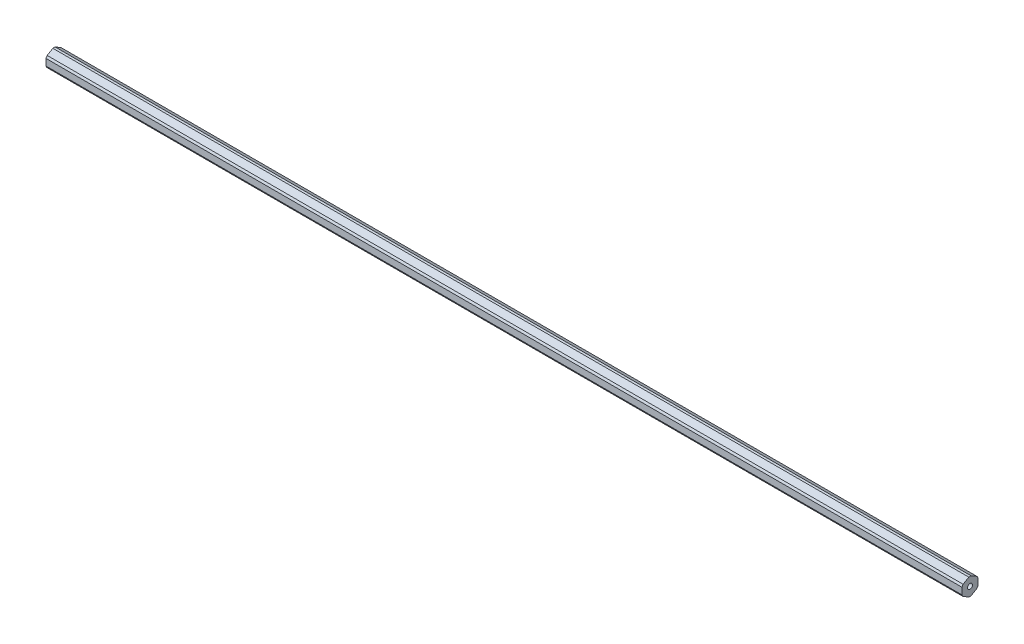
from build123d import *

# Parameters (mm, degrees)
SKETCH1_R           = 1.9939
BOSS_EXTRUDE1_DEPTH = 361.95


with BuildPart() as part:
    # Sketch1 → Boss-Extrude1 (new, symmetric)
    with BuildSketch(Plane(origin=(914.4, 0, 0), x_dir=(0, 0, -1), z_dir=(1, 0, 0))):
        with BuildLine():
            Line((-5.43426841, -4.194872089), (-0.91573159, -6.803650539))
            ThreePointArc((-0.91573159, -6.803650539), (0, -6.865), (0.91573159, -6.803650539))
            Line((0.91573159, -6.803650539), (5.43426841, -4.194872089))
            ThreePointArc((5.43426841, -4.194872089), (5.945264397, -3.4325), (6.35, -2.60877845))
            Line((6.35, -2.60877845), (6.35, 2.60877845))
            ThreePointArc((6.35, 2.60877845), (5.945264397, 3.4325), (5.43426841, 4.194872089))
            Line((5.43426841, 4.194872089), (0.91573159, 6.803650539))
            ThreePointArc((0.91573159, 6.803650539), (0, 6.865), (-0.91573159, 6.803650539))
            Line((-0.91573159, 6.803650539), (-5.43426841, 4.194872089))
            ThreePointArc((-5.43426841, 4.194872089), (-5.945264397, 3.4325), (-6.35, 2.60877845))
            Line((-6.35, 2.60877845), (-6.35, -2.60877845))
            ThreePointArc((-6.35, -2.60877845), (-5.945264397, -3.4325), (-5.43426841, -4.194872089))
        make_face()
        Circle(SKETCH1_R, mode=Mode.SUBTRACT)
    extrude(amount=BOSS_EXTRUDE1_DEPTH, both=True)


solid = part.part
